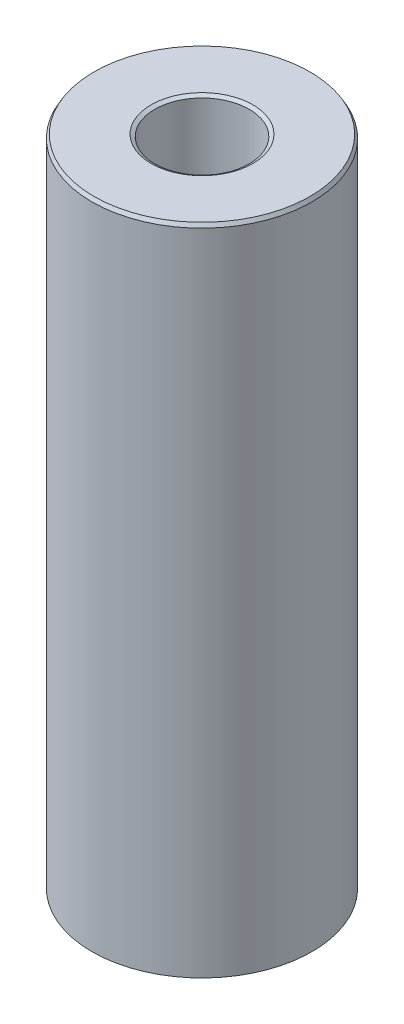
from build123d import *
from OCP.BRepFilletAPI import BRepFilletAPI_MakeChamfer

# Parameters (mm, degrees)
SKETCH1_R           = 52.5
BOSS_EXTRUDE1_DEPTH = 312.460441923
SKETCH2_R           = 22.550814675
CUT_EXTRUDE1_DEPTH  = 322.160439292
CHAMFER1_SIZE       = 1.72931355
CHAMFER1_SIZE2      = 0.998419643


with BuildPart() as part:
    # Sketch1 → Boss-Extrude1 (new body)
    with BuildSketch(Plane(origin=(0, 0, 0), x_dir=(1, 0, 0), z_dir=(0, 1, 0))):
        Circle(SKETCH1_R)
    extrude(amount=BOSS_EXTRUDE1_DEPTH)

    # Sketch2 → Cut-Extrude1 (cut, through all)
    with BuildSketch(Plane(origin=(0, 0, 0), x_dir=(1, 0, 0), z_dir=(0, 1, 0))):
        Circle(SKETCH2_R)
    extrude(amount=CUT_EXTRUDE1_DEPTH, mode=Mode.SUBTRACT)

    # Chamfer1: one chamfer whose edges measure the first distance from different faces: ONE call of the kernel's chamfer builder (chamfer() names one face for all edges)
    chamfer1_edges_1 = [part.edges().sort_by_distance(p)[0] for p in [
        (-22.550814675, 312.460441923, 0),
    ]]
    chamfer1_side_1 = [part.faces().sort_by_distance(p)[0] for p in [
        (-51.01507576, 312.460441923, 0),
    ]]
    chamfer1_edges_2 = [part.edges().sort_by_distance(p)[0] for p in [
        (-22.550814675, 0, 0),
    ]]
    chamfer1_side_2 = [part.faces().sort_by_distance(p)[0] for p in [
        (-22.550814675, 156.230220961, 0),
    ]]
    chamfer1_edges_3 = [part.edges().sort_by_distance(p)[0] for p in [
        (-52.5, 0, 0),
    ]]
    chamfer1_side_3 = [part.faces().sort_by_distance(p)[0] for p in [
        (-51.01507576, 0, 0),
    ]]
    chamfer1_edges_4 = [part.edges().sort_by_distance(p)[0] for p in [
        (-52.5, 312.460441923, 0),
    ]]
    chamfer1_side_4 = [part.faces().sort_by_distance(p)[0] for p in [
        (-52.5, 156.230220961, 0),
    ]]
    chamfer1 = BRepFilletAPI_MakeChamfer(part.part.solid().wrapped)
    for e in chamfer1_edges_1:
        chamfer1.Add(CHAMFER1_SIZE, CHAMFER1_SIZE2, e.wrapped, chamfer1_side_1[0].wrapped)  # the first distance lies on this face
    for e in chamfer1_edges_2:
        chamfer1.Add(CHAMFER1_SIZE, CHAMFER1_SIZE2, e.wrapped, chamfer1_side_2[0].wrapped)  # the first distance lies on this face
    for e in chamfer1_edges_3:
        chamfer1.Add(CHAMFER1_SIZE, CHAMFER1_SIZE2, e.wrapped, chamfer1_side_3[0].wrapped)  # the first distance lies on this face
    for e in chamfer1_edges_4:
        chamfer1.Add(CHAMFER1_SIZE, CHAMFER1_SIZE2, e.wrapped, chamfer1_side_4[0].wrapped)  # the first distance lies on this face
    add(Compound.cast(chamfer1.Shape()), mode=Mode.REPLACE)


solid = part.part
